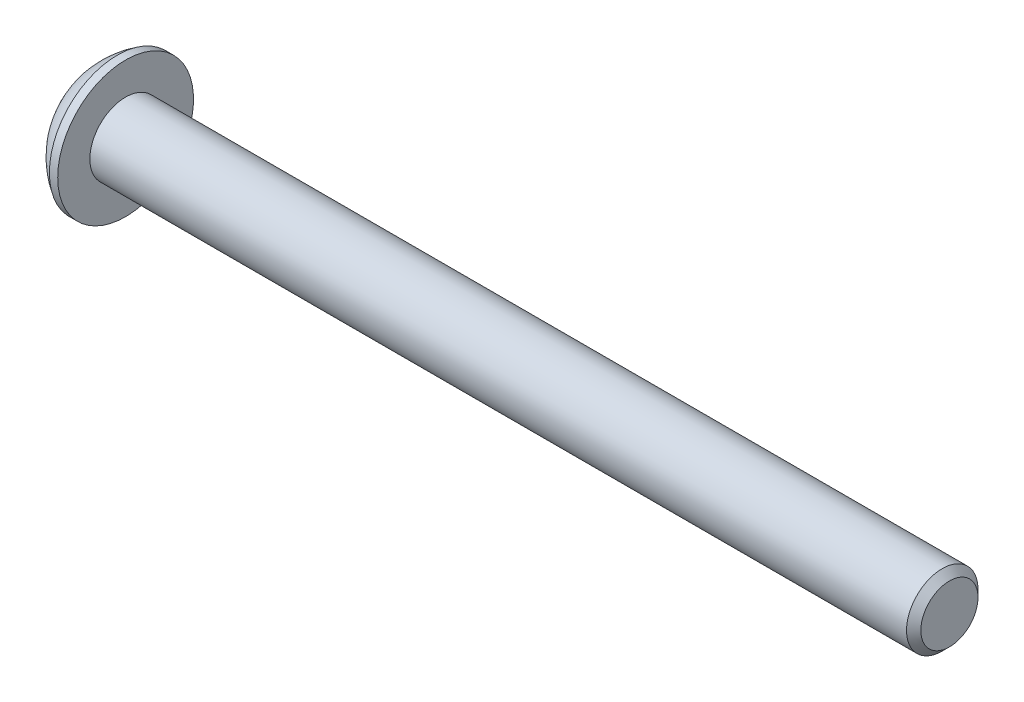
from build123d import *

# Parameters (mm, degrees)
ENL_V_MAT_EXTRU_3_DEPTH = 1


with BuildPart() as part:
    # Esquisse1 → Révolution1 (revolve)
    with BuildSketch(Plane.XY):
        with BuildLine():
            Line((56.936786978, 1.425), (56.936786978, 0))
            Line((56.936786978, 0), (93.166786978, 0))
            Line((93.166786978, 0), (93.166786978, 1.2))
            Line((93.166786978, 1.2), (92.866786978, 1.5))
            Line((92.866786978, 1.5), (58.586786978, 1.5))
            Line((58.586786978, 1.5), (58.586786978, 2.85))
            Line((58.586786978, 2.85), (58.236786978, 2.85))
            ThreePointArc((58.236786978, 2.85), (57.482006526, 2.233089184), (56.936786978, 1.425))
        make_face()
    revolve(axis=Axis((-65.342662182, 0, 0), (1, 0, 0)))

    # Esquisse2 → Enlèv. mat.-Extru.3 (cut)
    with BuildSketch(Plane.ZY.offset(-56.936786978)):
        Polygon((-1, -0.577350269), (0, -1.154700538), (1, -0.577350269), (1, 0.577350269), (0, 1.154700538), (-1, 0.577350269), align=None)
    extrude(amount=-ENL_V_MAT_EXTRU_3_DEPTH, mode=Mode.SUBTRACT)


solid = part.part
